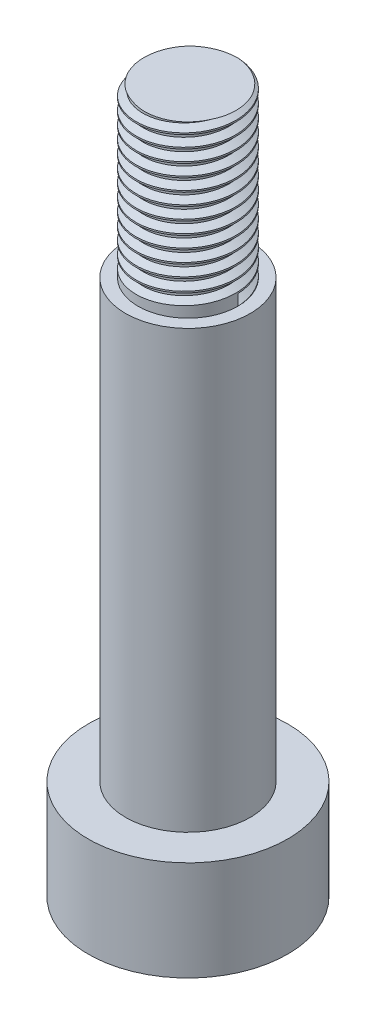
from build123d import *
from build123d.topology import SkipClean

# Parameters (mm, degrees)
SKETCH_1_R      = 5
EXTRUDE_1_DEPTH = 35
SKETCH_2_R      = 4
EXTRUDE_2_DEPTH = 13.25
THREAD_1_PITCH  = 1
SKETCH_7_R      = 8
EXTRUDE_3_DEPTH = 8


with BuildPart() as part:
    # Sketch 1 → 凸台-拉伸1 (new body)
    with BuildSketch(Plane(origin=(0, 0, 0), x_dir=(1, 0, 0), z_dir=(0, 1, 0))):
        with Locations(Location((0, 0, 0), (0, 0, 270))):
            Circle(SKETCH_1_R)
    extrude(amount=EXTRUDE_1_DEPTH)

    # 草图2 → 凸台-拉伸2 (add)
    with BuildSketch(Plane(origin=(0, 35, 0), x_dir=(1, 0, 0), z_dir=(0, 1, 0))):
        with Locations(Location((0, 0, 0), (0, 0, 270))):
            Circle(SKETCH_2_R)
    extrude(amount=EXTRUDE_2_DEPTH)

    # 螺纹线1: the profile of Sketch 1 2 profile screwed along a right-hand helix of 15 turns, 8 arcs to a turn; built about Z, then put on its axis
    with SkipClean():  # the faces are left unmerged after this step: merging them gives an invalid solid
        thread_1_z = Axis((0, 0, 0), (0, 0, 1))
        thread_1_corners = [(4.0003, 0, -0.000173205), (4.0003, 0, 0.875173202), (3.458734125, 0, 0.562499999), (3.458734125, 0, 0.312499999)]
        with BuildLine(mode=Mode.PRIVATE) as thread_1_profile:
            Line(thread_1_corners[0], thread_1_corners[1])
            Line(thread_1_corners[1], thread_1_corners[2])
            Line(thread_1_corners[2], thread_1_corners[3])
            Line(thread_1_corners[3], thread_1_corners[0])
        thread_1_cap = Face(thread_1_profile.wire())
        thread_1_turn_angles = [0, 22.5, 45, 67.5, 90, 112.5, 135, 157.5, 180, 202.5, 225, 247.5, 270, 292.5, 315, 337.5, 360]
        thread_1_turn_weights = [1, 0.9238795325112867, 1, 0.9238795325112867, 1, 0.9238795325112867, 1, 0.9238795325112867, 1, 0.9238795325112867, 1, 0.9238795325112867, 1, 0.9238795325112867, 1, 0.9238795325112867, 1]
        thread_1_turn_rails = [Edge.make_bspline([Vector(p[0], p[1], 0).rotate(thread_1_z, thread_1_turn_angles[k]) / thread_1_turn_weights[k] + Vector(0, 0, p[2] + THREAD_1_PITCH * thread_1_turn_angles[k] / 360) for k in range(17)], [0, 0, 0, 1, 1, 2, 2, 3, 3, 4, 4, 5, 5, 6, 6, 7, 7, 8, 8, 8], 2, thread_1_turn_weights) for p in thread_1_corners]
        thread_1_turn_sides = [Face.make_surface_from_curves(thread_1_turn_rails[p[0]], thread_1_turn_rails[p[1]]) for p in [(0, 1), (1, 2), (2, 3), (3, 0)]]
        thread_1 = Plane(origin=(0, 35, 0), x_dir=(1, 0, 0), z_dir=(0, 1, 0)) * Solid(Shell([*[p.moved(Location((0, 0, THREAD_1_PITCH * i))) for i in range(15) for p in thread_1_turn_sides], thread_1_cap, thread_1_cap.rotate(thread_1_z, 5400).moved(Location((0, 0, THREAD_1_PITCH * 5400 / 360)))]))
        add(thread_1, mode=Mode.SUBTRACT)

    # 草图7 → 凸台-拉伸3 (add)
    with SkipClean():  # the faces are left unmerged after this step: merging them gives an invalid solid
        with BuildSketch(Plane(origin=(0, 0, 0), x_dir=(-1, 0, 0), z_dir=(0, -1, 0))):
            with Locations(Location((0, 0, 0), (0, 0, 90))):
                Circle(SKETCH_7_R)
        extrude(amount=EXTRUDE_3_DEPTH)


solid = part.part
